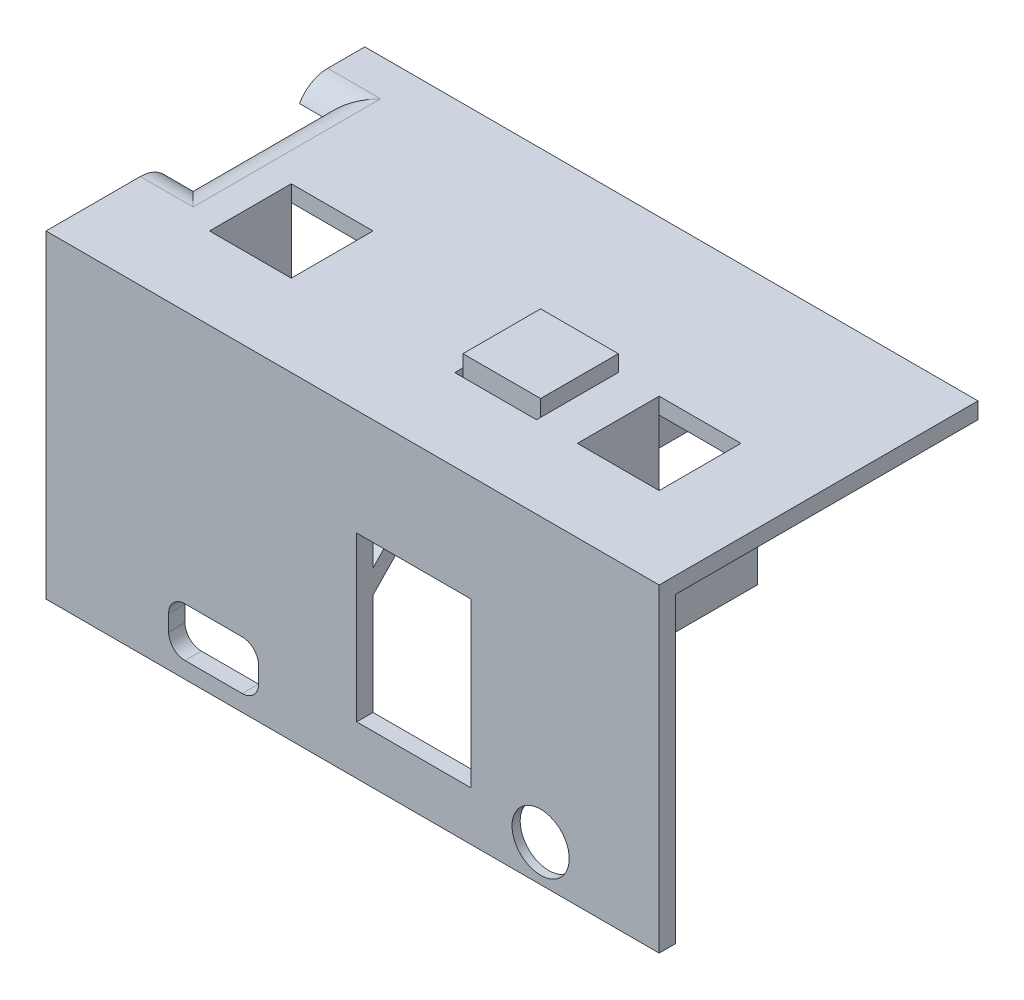
from build123d import *

# Parameters (mm, degrees)
SKETCH1_W                 = 75
SKETCH1_H                 = 39
BOSS_EXTRUDE1_DEPTH       = 2
SKETCH2_W                 = 75
SKETCH2_H                 = 2
BOSS_EXTRUDE2_DEPTH       = 38
SKETCH4_R                 = 3.5
SKETCH4_R_2               = 2.25
SKETCH4_W                 = 11
SKETCH4_H                 = 6
CUT_EXTRUDE1_DEPTH        = 2
SKETCH6_W                 = 10
SKETCH6_H                 = 10
CUT_EXTRUDE2_DEPTH        = 2
BOSS_EXTRUDE3_DEPTH       = 10
SKETCH8_W                 = 14
SKETCH8_H                 = 12
BOSS_EXTRUDE4_DEPTH       = 2
SKETCH9_W                 = 10
SKETCH9_H                 = 10
BOSS_EXTRUDE5_DEPTH       = 4
SKETCH10_W                = 9.9
SKETCH10_H                = 9.9
SKETCH10_W_2              = 5.9
SKETCH10_H_2              = 5.9
BOSS_EXTRUDE9_DEPTH       = 2
SKETCH11_W                = 9.9
SKETCH11_H                = 1.85
BOSS_EXTRUDE10_DEPTH      = 4
SKETCH12_R                = 4.25
SKETCH12_R_2              = 2.25
BOSS_EXTRUDE11_DEPTH      = 2
SKETCH16_W                = 14
SKETCH16_H                = 9.5
SKETCH16_W_2              = 11
SKETCH16_H_2              = 6
BOSS_EXTRUDE13_DEPTH      = 2
CUT_EXTRUDE3_DEPTH        = 65.955754172
FILLET1_R                 = 2
FILLET2_R                 = 2
BOSS_EXTRUDE14_DEPTH      = 2
BOSS_EXTRUDE14_DEPTH_BACK = 2
CUT_EXTRUDE4_DEPTH        = 7
CUT_EXTRUDE4_DEPTH_BACK   = 10
SKETCH19_W                = 14
SKETCH19_H                = 20
SKETCH22_W                = 14
SKETCH22_H                = 14
BOSS_EXTRUDE15_DEPTH      = 3
FILLET3_R                 = 7
SKETCH23_R                = 3.05
CUT_EXTRUDE6_DEPTH        = 4
SKETCH24_W                = 1
SKETCH24_H                = 12
BOSS_EXTRUDE16_DEPTH      = 12
SKETCH25_W                = 16.318850604
SKETCH25_H                = 8.975597068
SKETCH25_W_2              = 14
SKETCH25_H_2              = 9.692484115
CUT_EXTRUDE7_DEPTH        = 2
CUT_EXTRUDE8_START        = -2
SKETCH26_R                = 4.25
CUT_EXTRUDE8_DEPTH        = 2
SKETCH27_R                = 2.25
BOSS_EXTRUDE17_DEPTH      = 2
SKETCH28_W                = 85.525995753
SKETCH28_H                = 26.786934063
CUT_EXTRUDE9_DEPTH        = 1
BOSS_EXTRUDE18_DEPTH      = 1
CUT_EXTRUDE10_DEPTH       = 10
CUT_EXTRUDE11_START       = -1
SKETCH31_W                = 15
SKETCH31_H                = 9
SKETCH31_R                = 3.5
CUT_EXTRUDE11_DEPTH       = 1
SKETCH32_W                = 20
SKETCH32_H                = 8
CUT_EXTRUDE12_DEPTH       = 1
BOSS_EXTRUDE19_START      = -1
SKETCH34_W                = 14
SKETCH34_H                = 1
BOSS_EXTRUDE19_DEPTH      = 1
SKETCH35_W                = 3
SKETCH35_H                = 16
CUT_EXTRUDE13_DEPTH       = 66.545785524
FILLET4_R                 = 4
SKETCH36_W                = 0.4
SKETCH36_H                = 4
CUT_EXTRUDE14_DEPTH       = 10
BOSS_EXTRUDE20_DEPTH      = 7
SKETCH38_W                = 22
SKETCH38_H                = 10
BOSS_EXTRUDE21_DEPTH      = 2


# Some blends are built 0.0001 mm under size
with BuildPart() as part:
    # Sketch1 → Boss-Extrude1 (new body)
    with BuildSketch(Plane.XY):
        Rectangle(SKETCH1_W, SKETCH1_H)
    extrude(amount=BOSS_EXTRUDE1_DEPTH)

    # Sketch2 → Boss-Extrude2 (add)
    with BuildSketch(Plane(origin=(0, 0, 0), x_dir=(-1, 0, 0), z_dir=(0, 0, -1))):
        with Locations((0, 18.5)):
            Rectangle(SKETCH2_W, SKETCH2_H)
    extrude(amount=BOSS_EXTRUDE2_DEPTH)

    # Sketch4 → Cut-Extrude1 (cut)
    with BuildSketch(Plane.XY.offset(2)):
        with Locations((23, -15)):
            Circle(SKETCH4_R)
        with Locations((23, 4.5)):
            Circle(SKETCH4_R_2)
        with Locations((-17, -14.5)):
            Rectangle(SKETCH4_W, SKETCH4_H)
    extrude(amount=-CUT_EXTRUDE1_DEPTH, mode=Mode.SUBTRACT)

    # Sketch6 → Cut-Extrude2 (cut)
    with BuildSketch(Plane(origin=(0, 19.5, 0), x_dir=(1, 0, 0), z_dir=(0, 1, 0))):
        with Locations((7.5, 13)):
            Rectangle(SKETCH6_W, SKETCH6_H)
        with Locations((22.5, 13)):
            Rectangle(SKETCH6_W, SKETCH6_H)
        with Locations((-22.5, 13)):
            Rectangle(SKETCH6_W, SKETCH6_H)
    extrude(amount=-CUT_EXTRUDE2_DEPTH, mode=Mode.SUBTRACT)

    # Sketch7 → Boss-Extrude3 (add)
    with BuildSketch(Plane.XZ.offset(-17.5)):
        Polygon((17.5, -8), (17.5, -18), (15.5, -18), (15.5, -8), (15.5, -6), (29.5, -6), (29.5, -8), (29.5, -18), (27.5, -18), (27.5, -8), align=None)
        Polygon((2.5, -8), (2.5, -18), (0.5, -18), (0.5, -8), (0.5, -6), (14.5, -6), (14.5, -8), (14.5, -18), (12.5, -18), (12.5, -8), align=None)
        Polygon((-17.5, -8), (-17.5, -18), (-15.5, -18), (-15.5, -8), (-15.5, -6), (-29.5, -6), (-29.5, -8), (-29.5, -18), (-27.5, -18), (-27.5, -8), align=None)
    extrude(amount=BOSS_EXTRUDE3_DEPTH)

    # Sketch8 → Boss-Extrude4 (add)
    with BuildSketch(Plane.XZ.offset(-7.5)):
        with Locations((-22.5, -12)):
            Rectangle(SKETCH8_W, SKETCH8_H)
        with Locations((7.5, -12)):
            Rectangle(SKETCH8_W, SKETCH8_H)
        with Locations((22.5, -12)):
            Rectangle(SKETCH8_W, SKETCH8_H)
    extrude(amount=BOSS_EXTRUDE4_DEPTH)

    # Sketch12 → Boss-Extrude11 (add)
    with BuildSketch(Plane(origin=(0, 0, 0), x_dir=(-1, 0, 0), z_dir=(0, 0, -1))):
        with Locations(Location((-23, 4.5, 0), (0, 0, 180))):
            Circle(SKETCH12_R)
        with Locations(Location((-23, 4.5, 0), (0, 0, 180))):
            Circle(SKETCH12_R_2, mode=Mode.SUBTRACT)
    extrude(amount=BOSS_EXTRUDE11_DEPTH)

    # Sketch16 → Boss-Extrude13 (add)
    with BuildSketch(Plane(origin=(0, 0, 0), x_dir=(-1, 0, 0), z_dir=(0, 0, -1))):
        with Locations((17, -14.75)):
            Rectangle(SKETCH16_W, SKETCH16_H)
        with Locations((17, -14.5)):
            Rectangle(SKETCH16_W_2, SKETCH16_H_2, mode=Mode.SUBTRACT)
    extrude(amount=BOSS_EXTRUDE13_DEPTH)

    # Fillet1
    fillet1_edges = [part.edges().sort_by_distance(p)[0] for p in [
        (-22.5, -17.5, 0),
        (-22.5, -11.5, 0),
        (-11.5, -11.5, 0),
        (-11.5, -17.5, 0),
    ]]
    fillet(fillet1_edges, radius=FILLET1_R)

    # Fillet2
    fillet2_edges = [part.edges().sort_by_distance(p)[0] for p in [
        (-10, -10, -1),
        (-24, -10, -1),
    ]]
    fillet(fillet2_edges, radius=FILLET2_R)

    # Sketch18 → Boss-Extrude14 (add, two sides: drawn at the far end of the back side and taken through both)
    with BuildSketch(Plane.ZY.offset(-BOSS_EXTRUDE14_DEPTH_BACK)):
        Polygon((-15.16634768, 17.5), (0, 1.799618541), (0, -1.079036274), (-17.947087746, 17.5), align=None)
    extrude(amount=BOSS_EXTRUDE14_DEPTH + BOSS_EXTRUDE14_DEPTH_BACK)

    # Sketch19 → Cut-Extrude4 (cut, two sides: drawn at the far end of the back side and taken through both)
    with BuildSketch(Plane(origin=(0, 0, 0), x_dir=(-1, 0, 0), z_dir=(0, 0, -1)).offset(-CUT_EXTRUDE4_DEPTH_BACK)):
        with Locations((-7.5, -3.5)):
            Rectangle(SKETCH19_W, SKETCH19_H)
    extrude(amount=CUT_EXTRUDE4_DEPTH + CUT_EXTRUDE4_DEPTH_BACK, mode=Mode.SUBTRACT)

    # Sketch22 → Boss-Extrude15 (add)
    with BuildSketch(Plane(origin=(0, 0, -38), x_dir=(-1, 0, 0), z_dir=(0, 0, -1))):
        with Locations((-22.5, 12.5)):
            Rectangle(SKETCH22_W, SKETCH22_H)
        with Locations((22.5, 12.5)):
            Rectangle(SKETCH22_W, SKETCH22_H)
    extrude(amount=-BOSS_EXTRUDE15_DEPTH)

    # Fillet3
    fillet3_edges = [part.edges().sort_by_distance(p)[0] for p in [
        (-29.5, 5.5, -36.5),
        (-15.5, 5.5, -36.5),
        (15.5, 5.5, -36.5),
        (29.5, 5.5, -36.5),
    ]]
    fillet(fillet3_edges, radius=FILLET3_R - 0.0001)  # a hair under: the kernel refuses the full size

    # Sketch23 → Cut-Extrude6 (cut)
    with BuildSketch(Plane(origin=(0, 0, -38), x_dir=(-1, 0, 0), z_dir=(0, 0, -1))):
        with Locations((-22.5, 12.5)):
            Circle(SKETCH23_R)
        with Locations((22.5, 12.5)):
            Circle(SKETCH23_R)
    extrude(amount=-CUT_EXTRUDE6_DEPTH, mode=Mode.SUBTRACT)

    # Sketch24 → Boss-Extrude16 (add)
    with BuildSketch(Plane.XZ.offset(-5.5)):
        with Locations((15, -12)):
            Rectangle(SKETCH24_W, SKETCH24_H)
    extrude(amount=-BOSS_EXTRUDE16_DEPTH)

    # Sketch25 → Cut-Extrude7 (cut)
    with BuildSketch(Plane(origin=(0, 0, -2), x_dir=(-1, 0, 0), z_dir=(0, 0, -1))):
        with Locations((-23, -15)):
            Rectangle(SKETCH25_W, SKETCH25_H)
        with Locations((17, -14.653757943)):
            Rectangle(SKETCH25_W_2, SKETCH25_H_2)
    extrude(amount=-CUT_EXTRUDE7_DEPTH, mode=Mode.SUBTRACT)

    # Sketch26 → Cut-Extrude8 (cut)
    with BuildSketch(Plane(origin=(0, 0, -2), x_dir=(-1, 0, 0), z_dir=(0, 0, -1)).offset(CUT_EXTRUDE8_START)):
        with Locations((-23, 4.5)):
            Circle(SKETCH26_R)
    extrude(amount=CUT_EXTRUDE8_DEPTH, mode=Mode.SUBTRACT)

    # Sketch27 → Boss-Extrude17 (add)
    with BuildSketch(Plane.XY.offset(2)):
        with Locations((23, 4.5)):
            Circle(SKETCH27_R)
    extrude(amount=-BOSS_EXTRUDE17_DEPTH)

    # Sketch28 → Cut-Extrude9 (cut)
    with BuildSketch(Plane(origin=(0, 0, -38), x_dir=(-1, 0, 0), z_dir=(0, 0, -1))):
        with Locations((0.270543114, 11.591218851)):
            Rectangle(SKETCH28_W, SKETCH28_H)
    extrude(amount=-CUT_EXTRUDE9_DEPTH, mode=Mode.SUBTRACT)

    # Sketch29 → Boss-Extrude18 (add)
    with BuildSketch(Plane.XY.offset(-35)):
        with BuildLine():
            Line((15.5, 17.5), (29.5, 17.5))
            Line((29.5, 17.5), (29.5, 12.5))
            ThreePointArc((29.5, 12.5), (22.5, 5.5), (15.5, 12.5))
            Line((15.5, 12.5), (15.5, 17.5))
        make_face()
    boss_extrude18 = extrude(amount=BOSS_EXTRUDE18_DEPTH)

    # Mirror1: Boss-Extrude18 across plane
    add(boss_extrude18.mirror(Plane.ZY))

    # Sketch31 → Cut-Extrude11 (cut)
    with BuildSketch(Plane(origin=(0, 0, 0), x_dir=(-1, 0, 0), z_dir=(0, 0, -1)).offset(CUT_EXTRUDE11_START)):
        with Locations((-24.5, -15)):
            Rectangle(SKETCH31_W, SKETCH31_H)
        with Locations(Location((-23, -15, 0), (0, 0, 180))):
            Circle(SKETCH31_R, mode=Mode.SUBTRACT)
    extrude(amount=CUT_EXTRUDE11_DEPTH, mode=Mode.SUBTRACT)

    # Sketch32 → Cut-Extrude12 (cut)
    with BuildSketch(Plane.XZ.offset(-17.5)):
        with Locations((0, -28)):
            Rectangle(SKETCH32_W, SKETCH32_H)
    extrude(amount=-CUT_EXTRUDE12_DEPTH, mode=Mode.SUBTRACT)

    # Sketch34 → Boss-Extrude19 (add)
    with BuildSketch(Plane.XZ.offset(-5.5).offset(BOSS_EXTRUDE19_START)):
        with Locations((7.5, -6.5)):
            Rectangle(SKETCH34_W, SKETCH34_H)
    extrude(amount=BOSS_EXTRUDE19_DEPTH)

    # Sketch35 → Cut-Extrude13 (cut, through all)
    with BuildSketch(Plane(origin=(0, 19.5, 0), x_dir=(1, 0, 0), z_dir=(0, 1, 0))):
        with Locations((-36, 21)):
            Rectangle(SKETCH35_W, SKETCH35_H)
    extrude(amount=-CUT_EXTRUDE13_DEPTH, mode=Mode.SUBTRACT)

    # Fillet4
    # the kernel refuses this fillet: 4 mm, written as the material it takes off along each edge
    with BuildSketch(Plane(origin=(-34.5, 19.5, -13), x_dir=(0, 0, 1), z_dir=(-1, 0, 0)), Plane(origin=(-46.160254038, 19.5, -29), x_dir=(0, 0, -1), z_dir=(1, 0, 0))) as fillet4_piece_1:
        with BuildLine():
            CenterArc((3.464101615, -4), FILLET4_R, 90, 60)
            Line((0, -2), (-0.069282032, -1.96))
            ThreePointArc((-0.069282032, -1.96), (-0.08, -1), (-0.08, 0))
            Line((-0.08, 0), (0, 0.08))
            Line((0, 0.08), (3.464101615, 0.08))
            Line((3.464101615, 0.08), (3.464101615, 0))
        make_face()
    extrude(amount=11.660254038, mode=Mode.SUBTRACT)
    with BuildSketch(Plane(origin=(-34.5, 19.5, -29), x_dir=(1, 0, 0), z_dir=(0, 0, 1))) as fillet4_piece_2:
        with BuildLine():
            CenterArc((3.464101615, -4), FILLET4_R, 90, 60)
            Line((0, -2), (-0.069282032, -1.96))
            ThreePointArc((-0.069282032, -1.96), (-0.08, -1), (-0.08, 0))
            Line((-0.08, 0), (0, 0.08))
            Line((0, 0.08), (3.464101615, 0.08))
            Line((3.464101615, 0.08), (3.464101615, 0))
        make_face()
    extrude(amount=16, mode=Mode.SUBTRACT)
    with BuildSketch(Plane(origin=(-25.839745962, 19.5, -13), x_dir=(0, 0, 1), z_dir=(-1, 0, 0))) as fillet4_piece_3a_section:
        with BuildLine():
            CenterArc((3.464101615, -4), FILLET4_R, 90, 60)
            Line((0, -2), (-0.069282032, -1.96))
            ThreePointArc((-0.069282032, -1.96), (-0.08, -1), (-0.08, 0))
            Line((-0.08, 0), (0, 0.08))
            Line((0, 0.08), (3.464101615, 0.08))
            Line((3.464101615, 0.08), (3.464101615, 0))
        make_face()
    fillet4_piece_3a = extrude(amount=20.320508076, mode=Mode.PRIVATE)
    fillet4_piece_3a = split(fillet4_piece_3a, bisect_by=Plane(origin=(-34.5, 18.981933156, -12.134758217), z_dir=(1, 0, 0)), keep=Keep.TOP, mode=Mode.PRIVATE)
    with BuildSketch(Plane(origin=(-34.5, 19.5, -29), x_dir=(1, 0, 0), z_dir=(0, 0, 1))) as fillet4_piece_3b_section:
        with BuildLine():
            CenterArc((3.464101615, -4), FILLET4_R, 90, 60)
            Line((0, -2), (-0.069282032, -1.96))
            ThreePointArc((-0.069282032, -1.96), (-0.08, -1), (-0.08, 0))
            Line((-0.08, 0), (0, 0.08))
            Line((0, 0.08), (3.464101615, 0.08))
            Line((3.464101615, 0.08), (3.464101615, 0))
        make_face()
    fillet4_piece_3b = extrude(amount=24.660254038, mode=Mode.PRIVATE)
    fillet4_piece_3b = split(fillet4_piece_3b, bisect_by=Plane(origin=(-33.634758217, 18.981933156, -13), z_dir=(0, 0, 1)), keep=Keep.TOP, mode=Mode.PRIVATE)
    fillet4_piece_3 = fillet4_piece_3a & fillet4_piece_3b
    add(fillet4_piece_3, mode=Mode.SUBTRACT)
    with BuildSketch(Plane(origin=(-34.5, 19.5, -37.660254038), x_dir=(1, 0, 0), z_dir=(0, 0, 1))) as fillet4_piece_4a_section:
        with BuildLine():
            CenterArc((3.464101615, -4), FILLET4_R, 90, 60)
            Line((0, -2), (-0.069282032, -1.96))
            ThreePointArc((-0.069282032, -1.96), (-0.08, -1), (-0.08, 0))
            Line((-0.08, 0), (0, 0.08))
            Line((0, 0.08), (3.464101615, 0.08))
            Line((3.464101615, 0.08), (3.464101615, 0))
        make_face()
    fillet4_piece_4a = extrude(amount=24.660254038, mode=Mode.PRIVATE)
    fillet4_piece_4a = split(fillet4_piece_4a, bisect_by=Plane(origin=(-33.634758217, 18.981933156, -29), z_dir=(0, 0, -1)), keep=Keep.TOP, mode=Mode.PRIVATE)
    with BuildSketch(Plane(origin=(-46.160254038, 19.5, -29), x_dir=(0, 0, -1), z_dir=(1, 0, 0))) as fillet4_piece_4b_section:
        with BuildLine():
            CenterArc((3.464101615, -4), FILLET4_R, 90, 60)
            Line((0, -2), (-0.069282032, -1.96))
            ThreePointArc((-0.069282032, -1.96), (-0.08, -1), (-0.08, 0))
            Line((-0.08, 0), (0, 0.08))
            Line((0, 0.08), (3.464101615, 0.08))
            Line((3.464101615, 0.08), (3.464101615, 0))
        make_face()
    fillet4_piece_4b = extrude(amount=20.320508076, mode=Mode.PRIVATE)
    fillet4_piece_4b = split(fillet4_piece_4b, bisect_by=Plane(origin=(-34.5, 18.981933156, -29.865241783), z_dir=(1, 0, 0)), keep=Keep.TOP, mode=Mode.PRIVATE)
    fillet4_piece_4 = fillet4_piece_4a & fillet4_piece_4b
    add(fillet4_piece_4, mode=Mode.SUBTRACT)


with BuildPart() as body_2:
    # Sketch9 → Boss-Extrude5 (new body)
    with BuildSketch(Plane.XZ.offset(-17.5)):
        with Locations((7.5, -13)):
            Rectangle(SKETCH9_W, SKETCH9_H)
    extrude(amount=-BOSS_EXTRUDE5_DEPTH)

    # Sketch10 → Boss-Extrude9 (add)
    with BuildSketch(Plane.XZ.offset(-17.5)):
        with Locations((7.55, -13.05)):
            Rectangle(SKETCH10_W, SKETCH10_H)
        with Locations((7.55, -13.05)):
            Rectangle(SKETCH10_W_2, SKETCH10_H_2, mode=Mode.SUBTRACT)
    extrude(amount=BOSS_EXTRUDE9_DEPTH)

    # Sketch11 → Boss-Extrude10 (add)
    with BuildSketch(Plane(origin=(0, 0, -18), x_dir=(-1, 0, 0), z_dir=(0, 0, -1))):
        with Locations((-7.55, 16.425)):
            Rectangle(SKETCH11_W, SKETCH11_H)
    extrude(amount=BOSS_EXTRUDE10_DEPTH)

    # Sketch17 → Cut-Extrude3 (cut, through all)
    with BuildSketch(Plane.XZ.offset(-17.5)):
        Polygon((2.5, -8.1), (2.5, -18), (2.6, -18), (2.6, -8.1), (12.5, -8.1), (12.5, -8), (2.6, -8), (2.5, -8), align=None)
    extrude(amount=-CUT_EXTRUDE3_DEPTH, mode=Mode.SUBTRACT)

    # Sketch30 → Cut-Extrude10 (cut)
    with BuildSketch(Plane(origin=(0, 21.5, 0), x_dir=(1, 0, 0), z_dir=(0, 1, 0))):
        Polygon((2.5, 18), (3, 18), (3, 8.5), (12.5, 8.5), (12.5, 8), (2.5, 8), align=None)
    extrude(amount=-CUT_EXTRUDE10_DEPTH, mode=Mode.SUBTRACT)

    # Sketch36 → Cut-Extrude14 (cut)
    with BuildSketch(Plane.XZ.offset(-15.5)):
        with Locations((2.8, -20)):
            Rectangle(SKETCH36_W, SKETCH36_H)
    extrude(amount=-CUT_EXTRUDE14_DEPTH, mode=Mode.SUBTRACT)


with BuildPart() as body_3:
    # Sketch37 → Boss-Extrude20 (new body)
    with BuildSketch(Plane.XZ.offset(-17.5)):
        Polygon((-10, -32), (-10, -33), (12, -33), (12, -23), (-10, -23), (-10, -24), (10, -24), (10, -32), align=None)
    extrude(amount=BOSS_EXTRUDE20_DEPTH)

    # Sketch38 → Boss-Extrude21 (add)
    with BuildSketch(Plane.XZ.offset(-10.5)):
        with Locations((1, -28)):
            Rectangle(SKETCH38_W, SKETCH38_H)
    extrude(amount=BOSS_EXTRUDE21_DEPTH)


solid = Compound([part.part, body_2.part, body_3.part])
